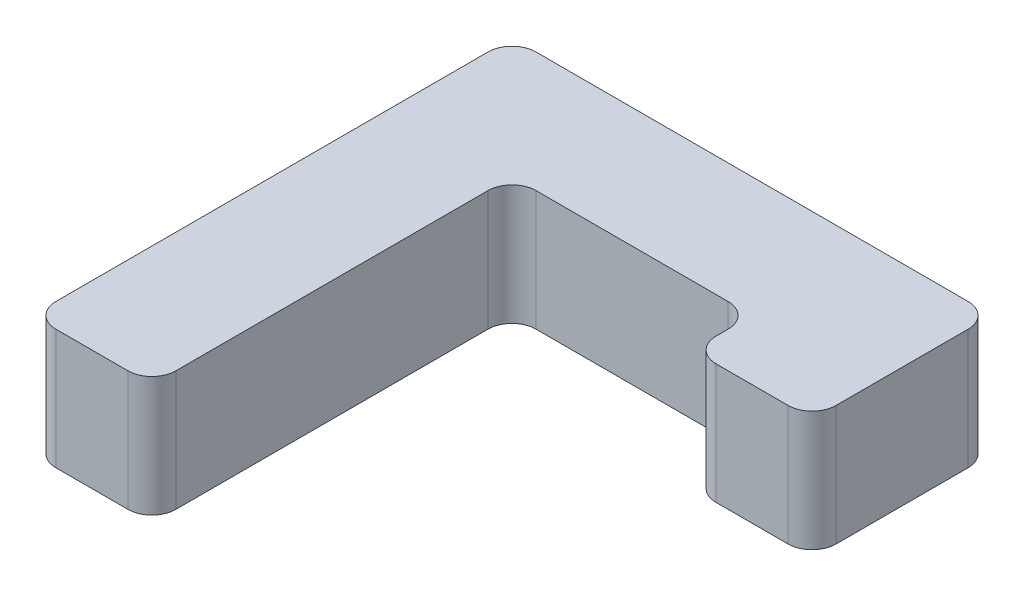
from build123d import *

# Parameters (mm, degrees)
BOSS_EXTRUDE1_DEPTH = 12.7
FILLET1_R           = 2.54


with BuildPart() as part:
    # Sketch1 → Boss-Extrude1 (new body)
    with BuildSketch(Plane(origin=(0, 0, 0), x_dir=(1, 0, 0), z_dir=(0, 1, 0))):
        Polygon((0, 0), (0, 50.8), (50.8, 50.8), (50.8, 31.75), (38.1, 31.75), (38.1, 38.1), (12.7, 38.1), (12.7, 0), align=None)
    extrude(amount=BOSS_EXTRUDE1_DEPTH)

    # Fillet1
    fillet1_edges = [part.edges().sort_by_distance(p)[0] for p in [
        (50.8, 6.35, -50.8),
        (38.1, 6.35, -38.1),
        (50.8, 6.35, -31.75),
        (38.1, 6.35, -31.75),
        (12.7, 6.35, 0),
        (0, 6.35, 0),
        (12.7, 6.35, -38.1),
        (0, 6.35, -50.8),
    ]]
    fillet(fillet1_edges, radius=FILLET1_R)


solid = part.part
